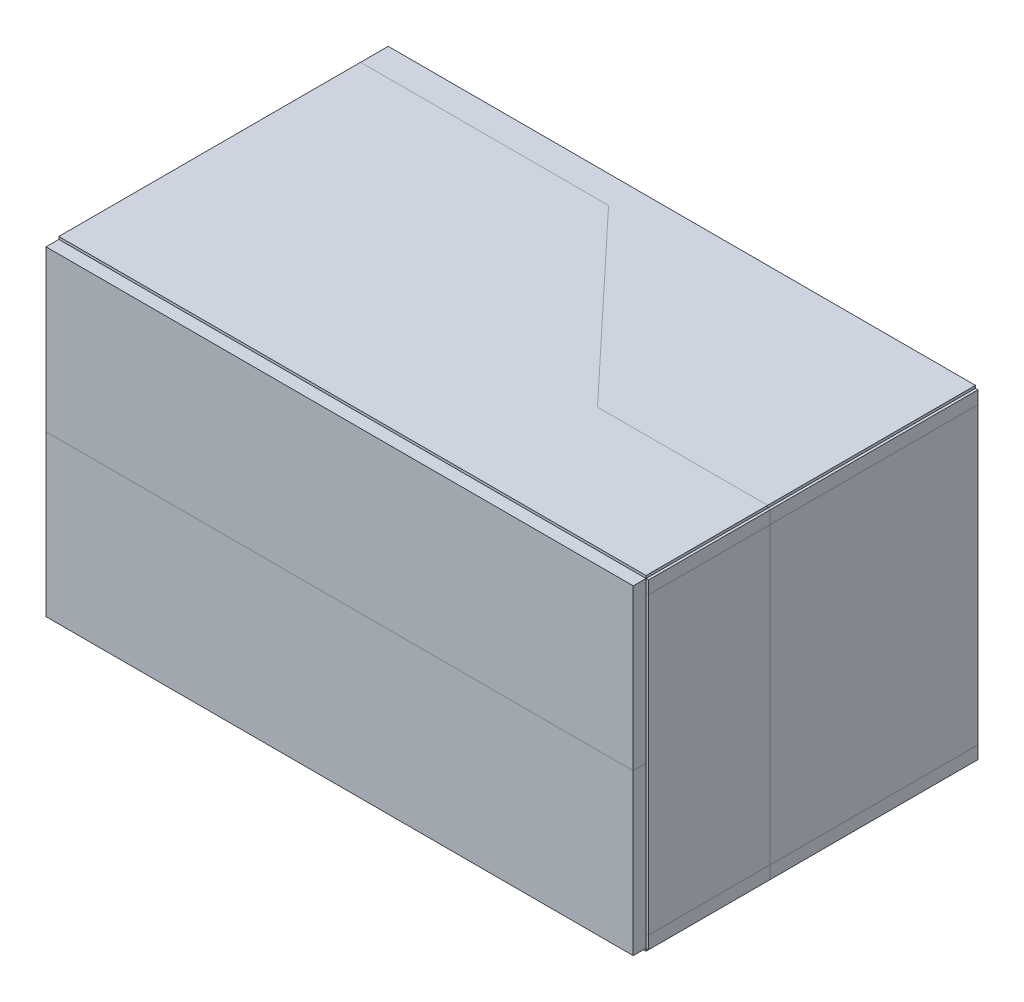
from build123d import *

# Parameters (mm, degrees)
SKETCH_1_W                    = 229
SKETCH_1_H                    = 124.895981316
EXTRUDE_1_DEPTH               = 7.860636733
SKETCH_2_W                    = 229
SKETCH_2_H                    = 5
CUT_EXTRUDE_1_DEPTH           = 7.860636733
SKETCH_4_W                    = 229
SKETCH_4_H                    = 5
CUT_EXTRUDE_2_DEPTH           = 7.860636733
SKETCH_5_W                    = 5
SKETCH_5_H                    = 114.895981316
CUT_EXTRUDE_3_DEPTH           = 7.860636733
SKETCH_6_W                    = 229
SKETCH_6_H                    = 128.442125646
EXTRUDE_3_DEPTH               = 5
SKETCH_7_W                    = 5
SKETCH_7_H                    = 114.895981316
EXTRUDE_4_DEPTH               = 120.581488912
SKETCH_8_W                    = 229
SKETCH_8_H                    = 128.442125646
EXTRUDE_5_DEPTH               = 5
SKETCH_9_W                    = 229
SKETCH_9_H                    = 62.45
EXTRUDE_6_DEPTH               = 5
SKETCH_10_W                   = 229
SKETCH_10_H                   = 62.445981316
EXTRUDE_7_DEPTH               = 5
SKETCH_11_W                   = 128.442125646
SKETCH_11_H                   = 114.895981316
EXTRUDE_8_DEPTH               = 5
EXTRUDE_9_DEPTH               = 1
EXTRUDE_10_DEPTH              = 1
SKETCH_14_W                   = 47.406489423
SKETCH_14_H                   = 5
EXTRUDE_11_DEPTH              = 1
SKETCH_15_W                   = 81.035636223
SKETCH_15_H                   = 5
EXTRUDE_12_DEPTH              = 1
SKETCH_16_W                   = 47.406489423
SKETCH_16_H                   = 114.895981316
EXTRUDE_13_DEPTH              = 1
SKETCH_17_W                   = 81.035636223
SKETCH_17_H                   = 114.895981316
EXTRUDE_14_DEPTH              = 1
SKETCH_18_W                   = 10
SKETCH_18_H                   = 105
EXTRUDE_15_DEPTH              = 10
SKETCH_19_W                   = 1
SKETCH_19_H                   = 99
EXTRUDE_16_DEPTH              = 77
EXTRUDE_17_DEPTH              = 3
EXTRUDE_17_DEPTH_BACK         = 101
SKETCH_20_R                   = 0.75
SKETCH_21_W                   = 8
SKETCH_21_H                   = 8
EXTRUDE_18_DEPTH              = 30
SKETCH_22_W                   = 30
SKETCH_22_H                   = 20
EXTRUDE_19_DEPTH              = 3
SKETCH_23_W                   = 28
SKETCH_23_H                   = 18
CUT_EXTRUDE_4_DEPTH           = 2
SKETCH_24_W                   = 25
SKETCH_24_H                   = 15
EXTRUDE_20_DEPTH              = 12
CUT_EXTRUDE_5_DEPTH           = 22
SKETCH_27_W                   = 5
SKETCH_27_H                   = 5
EXTRUDE_21_DEPTH              = 35
SKETCH_28_W                   = 90
SKETCH_28_H                   = 35.870302304
EXTRUDE_22_DEPTH              = 70
SKETCH_29_W                   = 90
SKETCH_29_H                   = 70
CUT_EXTRUDE_6_DEPTH           = 5
CUT_EXTRUDE_7_DEPTH           = 35
EXTRUDE_23_DEPTH              = 5
SKETCH_32_W                   = 15
SKETCH_32_H                   = 5
EXTRUDE_24_DEPTH              = 5
SKETCH_33_W                   = 7
SKETCH_33_H                   = 12
EXTRUDE_25_DEPTH              = 3
FILLET_1_R                    = 3
FILLET_2_R                    = 3
FILLET_3_R                    = 3
FILLET_4_R                    = 3
FILLET_5_R                    = 3
SKETCH_35_W                   = 4
SKETCH_35_H                   = 30.870302304
EXTRUDE_26_DEPTH              = 6
SKETCH_38_W                   = 46
SKETCH_38_H                   = 29
EXTRUDE_27_DEPTH              = 6
SKETCH_39_W                   = 44
SKETCH_39_H                   = 27
CUT_EXTRUDE_8_DEPTH           = 3
SKETCH_40_W                   = 35
SKETCH_40_H                   = 20
EXTRUDE_28_DEPTH              = 15
FILLET_6_R                    = 3
PATTERN_LINEAR_1_COUNT        = 3
PATTERN_LINEAR_1_PITCH        = 60
EXTRUDE_29_DEPTH              = 55
SKETCH_42_R                   = 7.5
CUT_EXTRUDE_9_DEPTH           = 5
CUT_EXTRUDE_9_DRAFT           = -30
CUT_EXTRUDE_9_PROFILE_2_DEPTH = 5
CUT_EXTRUDE_9_PROFILE_2_DRAFT = -30
SKETCH_43_R                   = 4.613248654
EXTRUDE_30_DEPTH              = 5


# Some blends are built 0.0001 mm under size
with BuildPart() as part:
    # 스케치1 → 보스-돌출1 (new body)
    with BuildSketch(Plane.XY):
        with Locations((165.5, 12.447990658)):
            Rectangle(SKETCH_1_W, SKETCH_1_H)
    extrude(amount=EXTRUDE_1_DEPTH)

    # 스케치2 → 컷-돌출1 (cut)
    with BuildSketch(Plane.XY.offset(7.860636733)):
        with Locations((165.5, 72.395981316)):
            Rectangle(SKETCH_2_W, SKETCH_2_H)
    extrude(amount=-CUT_EXTRUDE_1_DEPTH, mode=Mode.SUBTRACT)

    # 스케치4 → 컷-돌출2 (cut)
    with BuildSketch(Plane.XY.offset(7.860636733)):
        with Locations((165.5, -47.5)):
            Rectangle(SKETCH_4_W, SKETCH_4_H)
    extrude(amount=-CUT_EXTRUDE_2_DEPTH, mode=Mode.SUBTRACT)

    # 스케치5 → 컷-돌출3 (cut)
    with BuildSketch(Plane.XY.offset(7.860636733)):
        with Locations((277.5, 12.447990658)):
            Rectangle(SKETCH_5_W, SKETCH_5_H)
    extrude(amount=-CUT_EXTRUDE_3_DEPTH, mode=Mode.SUBTRACT)


with BuildPart() as body_2:
    # 스케치6 → 보스-돌출3 (new body)
    with BuildSketch(Plane(origin=(0, 69.895981316, 0), x_dir=(1, 0, 0), z_dir=(0, 1, 0))):
        with Locations((165.5, -64.221062823)):
            Rectangle(SKETCH_6_W, SKETCH_6_H)
    extrude(amount=EXTRUDE_3_DEPTH)


with BuildPart() as body_3:
    # 스케치7 → 보스-돌출4 (new body)
    with BuildSketch(Plane.XY.offset(7.860636733)):
        with Locations((53.5, 12.447990658)):
            Rectangle(SKETCH_7_W, SKETCH_7_H)
    extrude(amount=EXTRUDE_4_DEPTH)


with BuildPart() as body_4:
    # 스케치8 → 보스-돌출5 (new body)
    with BuildSketch(Plane.XZ.offset(45)):
        with Locations((165.5, 64.221062823)):
            Rectangle(SKETCH_8_W, SKETCH_8_H)
    extrude(amount=EXTRUDE_5_DEPTH)


with BuildPart() as body_5:
    # 스케치9 → 보스-돌출6 (new body)
    with BuildSketch(Plane.XY.offset(128.442125646)):
        with Locations((165.5, 43.670981316)):
            Rectangle(SKETCH_9_W, SKETCH_9_H)
    extrude(amount=EXTRUDE_6_DEPTH)


with BuildPart() as body_6:
    # 스케치10 → 보스-돌출7 (new body)
    with BuildSketch(Plane.XY.offset(128.442125646)):
        with Locations((165.5, -18.777009342)):
            Rectangle(SKETCH_10_W, SKETCH_10_H)
    extrude(amount=EXTRUDE_7_DEPTH)


with BuildPart() as body_7:
    # 스케치11 → 보스-돌출8 (new body)
    with BuildSketch(Plane(origin=(275, 0, 0), x_dir=(0, 0, -1), z_dir=(1, 0, 0))):
        with Locations((-64.221062823, 12.447990658)):
            Rectangle(SKETCH_11_W, SKETCH_11_H)
    extrude(amount=EXTRUDE_8_DEPTH)


with BuildPart() as body_8:
    # 스케치12 → 보스-돌출9 (new body)
    with BuildSketch(Plane.XZ.offset(50)):
        Polygon((51, 10.771238208), (147.705868367, 10.771238208), (213.658520424, 81.035636223), (280, 81.035636223), (280, 0), (51, 0), align=None)
    extrude(amount=EXTRUDE_9_DEPTH)


with BuildPart() as body_9:
    # 스케치13 → 보스-돌출10 (new body)
    with BuildSketch(Plane.XZ.offset(50)):
        Polygon((51, 128.442125646), (51, 10.771238208), (147.705868367, 10.771238208), (213.658520424, 81.035636223), (280, 81.035636223), (280, 128.442125646), align=None)
    extrude(amount=EXTRUDE_10_DEPTH)


with BuildPart() as body_10:
    # 스케치14 → 보스-돌출11 (new body)
    with BuildSketch(Plane(origin=(280, 0, 0), x_dir=(0, 0, -1), z_dir=(1, 0, 0))):
        with Locations((-104.738880935, -47.5)):
            Rectangle(SKETCH_14_W, SKETCH_14_H)
    extrude(amount=EXTRUDE_11_DEPTH)


with BuildPart() as body_11:
    # 스케치15 → 보스-돌출12 (new body)
    with BuildSketch(Plane(origin=(280, 0, 0), x_dir=(0, 0, -1), z_dir=(1, 0, 0))):
        with Locations((-40.517818112, -47.5)):
            Rectangle(SKETCH_15_W, SKETCH_15_H)
    extrude(amount=EXTRUDE_12_DEPTH)


with BuildPart() as body_12:
    # 스케치16 → 보스-돌출13 (new body)
    with BuildSketch(Plane(origin=(280, 0, 0), x_dir=(0, 0, -1), z_dir=(1, 0, 0))):
        with Locations((-104.738880935, 12.447990658)):
            Rectangle(SKETCH_16_W, SKETCH_16_H)
    extrude(amount=EXTRUDE_13_DEPTH)


with BuildPart() as body_13:
    # 스케치17 → 보스-돌출14 (new body)
    with BuildSketch(Plane(origin=(280, 0, 0), x_dir=(0, 0, -1), z_dir=(1, 0, 0))):
        with Locations((-40.517818112, 12.447990658)):
            Rectangle(SKETCH_17_W, SKETCH_17_H)
    extrude(amount=EXTRUDE_14_DEPTH)


with BuildPart() as body_14:
    # 대칭 복사2: mirrored copy
    add(body_8.part.mirror(Plane.ZX.offset(12.445981316)))


with BuildPart() as body_15:
    # Mirror 2 2: mirrored copy
    add(body_9.part.mirror(Plane.ZX.offset(12.445981316)))


with BuildPart() as body_16:
    # Mirror 2 3: mirrored copy
    add(body_10.part.mirror(Plane.ZX.offset(12.445981316)))


with BuildPart() as body_17:
    # Mirror 2 4: mirrored copy
    add(body_11.part.mirror(Plane.ZX.offset(12.445981316)))


with BuildPart() as body_18:
    # 스케치18 → 보스-돌출15 (new body)
    with BuildSketch(Plane(origin=(56, 0, 0), x_dir=(0, 0, -1), z_dir=(1, 0, 0))):
        with Locations((-119.442125646, 12.395981316)):
            Rectangle(SKETCH_18_W, SKETCH_18_H)
    extrude(amount=EXTRUDE_15_DEPTH)


with BuildPart() as body_19:
    # 스케치19 → 보스-돌출16 (new body)
    with BuildSketch(Plane(origin=(0, 0, 114.442125646), x_dir=(-1, 0, 0), z_dir=(0, 0, -1))):
        with Locations((-62.5, 12.395981316)):
            Rectangle(SKETCH_19_W, SKETCH_19_H)
    extrude(amount=EXTRUDE_16_DEPTH)


with BuildPart() as body_20:
    # 스케치20 → 보스-돌출17 (new, two sides: drawn at the far end of the back side and taken through both)
    with BuildSketch(Plane.XZ.offset(37.104018684).offset(-EXTRUDE_17_DEPTH_BACK)):
        with Locations(Location((62.5, 37.442125646, 0), (0, 0, 270))):
            Circle(SKETCH_20_R)
    extrude(amount=EXTRUDE_17_DEPTH + EXTRUDE_17_DEPTH_BACK)


with BuildPart() as body_21:
    # 스케치21 → 보스-돌출18 (new body)
    with BuildSketch(Plane.XY.offset(7.860636733)):
        with Locations((97.544483238, 12.447990658)):
            Rectangle(SKETCH_21_W, SKETCH_21_H)
    extrude(amount=EXTRUDE_18_DEPTH)

    # 스케치22 → 보스-돌출19 (add)
    with BuildSketch(Plane.XY.offset(37.860636733)):
        with Locations((97.544483238, 12.447990658)):
            Rectangle(SKETCH_22_W, SKETCH_22_H)
    extrude(amount=EXTRUDE_19_DEPTH)

    # 스케치23 → 컷-돌출4 (cut)
    with BuildSketch(Plane.XY.offset(40.860636733)):
        with Locations((97.544483238, 12.447990658)):
            Rectangle(SKETCH_23_W, SKETCH_23_H)
    extrude(amount=-CUT_EXTRUDE_4_DEPTH, mode=Mode.SUBTRACT)


with BuildPart() as body_22:
    # 스케치24 → 보스-돌출20 (new body)
    with BuildSketch(Plane.XY.offset(38.860636733)):
        with Locations((97.544483238, 12.447990658)):
            Rectangle(SKETCH_24_W, SKETCH_24_H)
    extrude(amount=EXTRUDE_20_DEPTH)

    # 스케치25 → 컷-돌출5 (cut)
    with BuildSketch(Plane.XZ.offset(-4.947990658)):
        with BuildLine():
            Line((94.448591143, 54.411319288), (105.530983661, 49.670695111))
            ThreePointArc((105.530983661, 49.670695111), (107.562819853, 44.601166194), (102.493290936, 42.569330002))
            Line((102.493290936, 42.569330002), (91.410898419, 47.309954179))
            ThreePointArc((91.410898419, 47.309954179), (89.379062226, 52.379483096), (94.448591143, 54.411319288))
        make_face()
    extrude(amount=-CUT_EXTRUDE_5_DEPTH, mode=Mode.SUBTRACT)


with BuildPart() as body_23:
    # 스케치27 → 보스-돌출21 (new body)
    with BuildSketch(Plane.XY.offset(7.860636733)):
        with Locations((205.326448138, 12.447990658)):
            Rectangle(SKETCH_27_W, SKETCH_27_H)
    extrude(amount=EXTRUDE_21_DEPTH)

    # 스케치38 → 보스-돌출27 (add)
    with BuildSketch(Plane.XY.offset(42.860636733)):
        with Locations((205.326448138, 12.447990658)):
            Rectangle(SKETCH_38_W, SKETCH_38_H)
    extrude(amount=EXTRUDE_27_DEPTH)

    # 스케치39 → 컷-돌출8 (cut)
    with BuildSketch(Plane.XY.offset(48.860636733)):
        with Locations((205.326448138, 12.447990658)):
            Rectangle(SKETCH_39_W, SKETCH_39_H)
    extrude(amount=-CUT_EXTRUDE_8_DEPTH, mode=Mode.SUBTRACT)


with BuildPart() as body_24:
    # 스케치28 → 보스-돌출22 (new body)
    with BuildSketch(Plane.XY.offset(7.860636733)):
        with Locations((208.5920471, -27.064848848)):
            Rectangle(SKETCH_28_W, SKETCH_28_H)
    extrude(amount=EXTRUDE_22_DEPTH)

    # 스케치29 → 컷-돌출6 (cut)
    with BuildSketch(Plane.XZ.offset(45)):
        with Locations((208.5920471, 42.860636733)):
            Rectangle(SKETCH_29_W, SKETCH_29_H)
    extrude(amount=-CUT_EXTRUDE_6_DEPTH, mode=Mode.SUBTRACT)

    # 스케치30 → 컷-돌출7 (cut)
    with BuildSketch(Plane.XZ.offset(40)):
        Polygon((163.5920471, 77.860636733), (163.5920471, 24.897257117), (192.02233044, 42.860636733), (219.847166655, 42.860636733), (253.5920471, 70.317210351), (253.5920471, 77.860636733), align=None)
    extrude(amount=-CUT_EXTRUDE_7_DEPTH, mode=Mode.SUBTRACT)

    # 스케치32 → 보스-돌출24 (add)
    with BuildSketch(Plane(origin=(66.588217506, 0, -81.838741792), x_dir=(0.7756766635634407, 0, 0.6311305044149657), z_dir=(-0.6311305044149655, 0, 0.7756766635634406))):
        with Locations((233.584769439, -11.629697696)):
            Rectangle(SKETCH_32_W, SKETCH_32_H)
        with Locations((233.584769439, -37.5)):
            Rectangle(SKETCH_32_W, SKETCH_32_H)
    extrude(amount=EXTRUDE_24_DEPTH)

    # 스케치33 → 보스-돌출25 (add)
    with BuildSketch(Plane(origin=(66.588217506, 0, -81.838741792), x_dir=(0.7756766635634407, 0, 0.6311305044149657), z_dir=(-0.6311305044149655, 0, 0.7756766635634406))):
        with Locations((233.584769439, -24.564848848)):
            Rectangle(SKETCH_33_W, SKETCH_33_H)
    extrude(amount=EXTRUDE_25_DEPTH)

    # 필렛1
    fillet_1_edges = [body_24.edges().sort_by_distance(p)[0] for p in [
        (252.014220839, -14.129697696, 72.25640201),
    ]]
    fillet(fillet_1_edges, radius=FILLET_1_R)

    # 필렛2
    fillet_2_edges = [body_24.edges().sort_by_distance(p)[0] for p in [
        (240.379070886, -14.129697696, 62.789444444),
    ]]
    fillet(fillet_2_edges, radius=FILLET_2_R)

    # 필렛3
    fillet_3_edges = [body_24.edges().sort_by_distance(p)[0] for p in [
        (240.379070886, -35, 62.789444444),
    ]]
    fillet(fillet_3_edges, radius=FILLET_3_R)

    # 필렛4
    # the kernel refuses this fillet: 3 mm, written as the material it takes off along each edge
    with BuildSketch(Plane(origin=(253.5920471, -35, 70.317210351), x_dir=(-0.7756766635634407, 0, -0.6311305044149655), z_dir=(-0.6311305044149657, 0, 0.7756766635634407))) as fillet_4_piece_1:
        with BuildLine():
            CenterArc((FILLET_4_R, FILLET_4_R), FILLET_4_R, 180, 90)
            Line((0, FILLET_4_R), (0, 0))
            Line((0, 0), (FILLET_4_R, 0))
        make_face()
    extrude(amount=12.5, mode=Mode.SUBTRACT)

    # 필렛5
    fillet_5_edges = [body_24.edges().sort_by_distance(p)[0] for p in [
        (248.595948933, -24.564848848, 70.119718324),
        (245.88108061, -18.564848848, 67.910761559),
        (243.166212288, -24.564848848, 65.701804793),
        (245.88108061, -30.564848848, 67.910761559),
    ]]
    fillet(fillet_5_edges, radius=FILLET_5_R - 0.0001)  # a hair under: the kernel refuses the full size

    # 스케치35 → 보스-돌출26 (add)
    with BuildSketch(Plane(origin=(35.432821004, 0, -56.078820477), x_dir=(0.8453893920145988, 0, 0.5341505179901889), z_dir=(-0.5341505179901889, 0, 0.8453893920145988))):
        with Locations((153.597864022, -24.564848848)):
            Rectangle(SKETCH_35_W, SKETCH_35_H)
    extrude(amount=EXTRUDE_26_DEPTH)


with BuildPart() as body_25:
    # 스케치31 → 보스-돌출23 (new body)
    with BuildSketch(Plane.XZ.offset(40)):
        with BuildLine():
            Line((192.02233044, 50.360636733), (219.847166655, 50.360636733))
            ThreePointArc((219.847166655, 50.360636733), (227.347166655, 42.860636733), (219.847166655, 35.360636733))
            Line((219.847166655, 35.360636733), (192.02233044, 35.360636733))
            ThreePointArc((192.02233044, 35.360636733), (184.52233044, 42.860636733), (192.02233044, 50.360636733))
        make_face()
    extrude(amount=EXTRUDE_23_DEPTH)


with BuildPart() as body_26:
    # 대칭 복사3: mirrored copy
    add(body_25.part.mirror(Plane.ZX.offset(-24.564848846)))


with BuildPart() as body_27:
    # 대칭 복사4: mirrored copy
    add(body_24.part.mirror(Plane(origin=(0, 12.44799066, 0), x_dir=(0, 0, 1), z_dir=(0, -1, 0))))


with BuildPart() as body_28:
    # Mirror 4 2: mirrored copy
    add(body_25.part.mirror(Plane(origin=(0, 12.44799066, 0), x_dir=(0, 0, 1), z_dir=(0, -1, 0))))


with BuildPart() as body_29:
    # Mirror 4 3: mirrored copy
    add(body_26.part.mirror(Plane(origin=(0, 12.44799066, 0), x_dir=(0, 0, 1), z_dir=(0, -1, 0))))


with BuildPart() as body_30:
    # 스케치40 → 보스-돌출28 (new body)
    with BuildSketch(Plane.XZ.offset(-69.895981316)):
        with Locations((108.213780914, 118.442125646)):
            Rectangle(SKETCH_40_W, SKETCH_40_H)
    extrude(amount=EXTRUDE_28_DEPTH)

    # 필렛6
    fillet_6_edges = [body_30.edges().sort_by_distance(p)[0] for p in [
        (108.213780914, 54.895981316, 108.442125646),
    ]]
    fillet(fillet_6_edges, radius=FILLET_6_R)


with BuildPart() as pattern_linear_1_1:
    # 선형 패턴1: pattern copy
    add(body_30.part.moved(Location(Vector(1, 0, 0) * (1 * PATTERN_LINEAR_1_PITCH))))


with BuildPart() as pattern_linear_1_2:
    # 선형 패턴1: pattern copy
    add(body_30.part.moved(Location(Vector(1, 0, 0) * (2 * PATTERN_LINEAR_1_PITCH))))


with BuildPart() as body_33:
    # 스케치41 → 보스-돌출29 (new body)
    with BuildSketch(Plane.XY.offset(7.860636733)):
        Polygon((77.186141542, -29.318387754), (90.253572074, -44.464727689), (96.51975679, -39.058607541), (83.452326259, -23.912267607), align=None)
    extrude(amount=EXTRUDE_29_DEPTH)


with BuildPart() as cut_extrude_9_tool:
    # 스케치42 → 컷-돌출9 (with draft: the straight prism first)
    with BuildSketch(Plane(origin=(36.015069889, 31.071825003, 0), x_dir=(0, 0, -1), z_dir=(0.7571567291791887, 0.6532332565467505, 0))):
        with Locations((-50.608196726, -82.621285879)):
            Circle(SKETCH_42_R)
    extrude(amount=-CUT_EXTRUDE_9_DEPTH)
    # 컷-돌출9: the draft: its side faces are tilted about the plane it starts from
    cut_extrude_9_sides = [cut_extrude_9_tool.faces().sort_by_distance(p)[0] for p in [
        (88.093149701, -33.118520716, 58.108196726),
    ]]
    draft(cut_extrude_9_sides, Plane(origin=(36.015069889, 31.071825003, 0), x_dir=(0, 0, -1), z_dir=(0.7571567291791887, 0.6532332565467505, 0)), CUT_EXTRUDE_9_DRAFT)


with BuildPart() as body_33_1:
    add(body_33.part)

    # 컷-돌출9: cut by cut_extrude_9_tool
    add(cut_extrude_9_tool.part, mode=Mode.SUBTRACT)


with BuildPart() as cut_extrude_9_profile_2_tool:
    # 스케치42 → 컷-돌출9 profile 2 (with draft: the straight prism first)
    with BuildSketch(Plane(origin=(36.015069889, 31.071825003, 0), x_dir=(0, 0, -1), z_dir=(0.7571567291791887, 0.6532332565467505, 0))):
        with Locations((-32.608196726, -82.621285879)):
            Circle(SKETCH_42_R)
    extrude(amount=-CUT_EXTRUDE_9_PROFILE_2_DEPTH)
    # 컷-돌출9 profile 2: the draft: its side faces are tilted about the plane it starts from
    cut_extrude_9_profile_2_sides = [cut_extrude_9_profile_2_tool.faces().sort_by_distance(p)[0] for p in [
        (88.093149701, -33.118520716, 40.108196726),
    ]]
    draft(cut_extrude_9_profile_2_sides, Plane(origin=(36.015069889, 31.071825003, 0), x_dir=(0, 0, -1), z_dir=(0.7571567291791887, 0.6532332565467505, 0)), CUT_EXTRUDE_9_PROFILE_2_DRAFT)


with BuildPart() as body_33_2:
    add(body_33_1.part)

    # 컷-돌출9 profile 2: cut by cut_extrude_9_profile_2_tool
    add(cut_extrude_9_profile_2_tool.part, mode=Mode.SUBTRACT)

    # 스케치43 → 보스-돌출30 (add)
    with BuildSketch(Plane(origin=(32.229286244, 27.80565872, 0), x_dir=(0, 0, -1), z_dir=(0.7571567291791887, 0.6532332565467506, 0))):
        with Locations(Location((-50.608196726, -82.621285879, 0), (0, 0, 90))):
            Circle(SKETCH_43_R)
        with Locations(Location((-32.608196726, -82.621285879, 0), (0, 0, 90))):
            Circle(SKETCH_43_R)
    extrude(amount=EXTRUDE_30_DEPTH)


with BuildPart() as body_34:
    # 대칭 복사5: mirrored copy
    add(body_33_2.part.mirror(Plane(origin=(0, 12.44799066, 0), x_dir=(0, 0, 1), z_dir=(0, -1, 0))))


solid = Compound([part.part, body_2.part, body_3.part, body_4.part, body_5.part, body_6.part, body_7.part, body_8.part, body_9.part, body_10.part, body_11.part, body_12.part, body_13.part, body_14.part, body_15.part, body_16.part, body_17.part, body_18.part, body_19.part, body_20.part, body_21.part, body_22.part, body_23.part, body_24.part, body_25.part, body_26.part, body_27.part, body_28.part, body_29.part, body_30.part, pattern_linear_1_1.part, pattern_linear_1_2.part, body_33_2.part, body_34.part])
